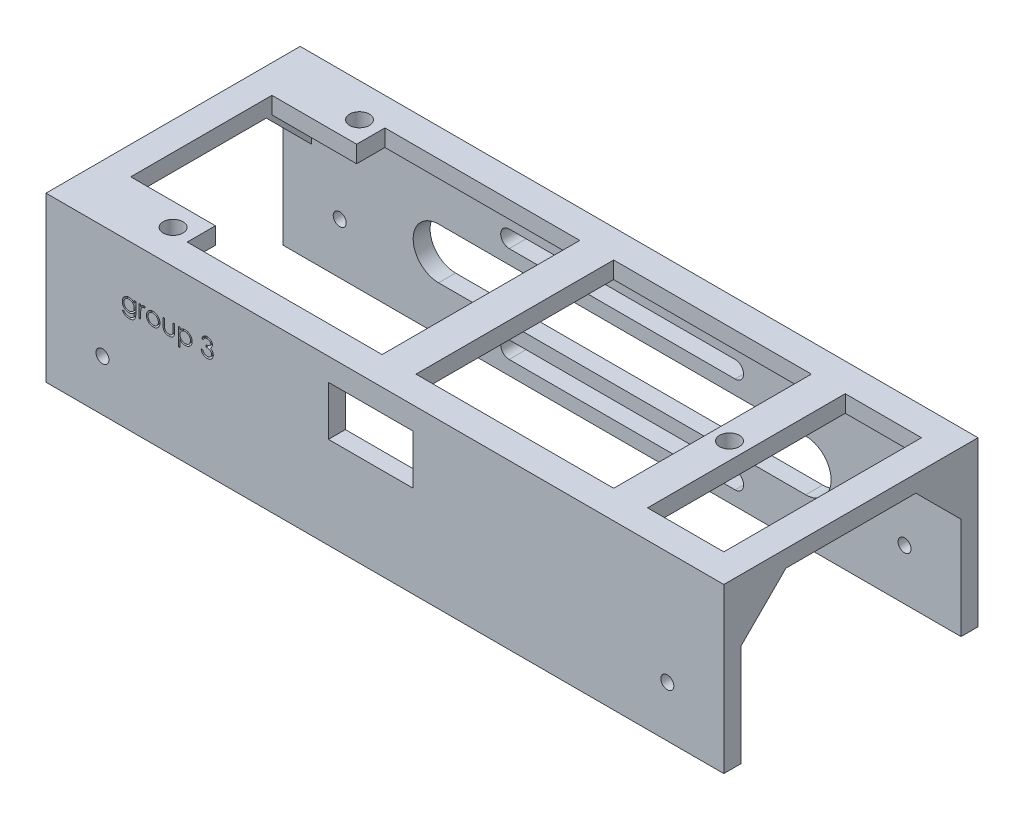
from build123d import *

# Parameters (mm, degrees)
SKETCH1_W           = 120
SKETCH1_H           = 29
BOSS_EXTRUDE5_DEPTH = 45
SHELL9_T            = -3
SKETCH3_R           = 1.15
CUT_EXTRUDE2_DEPTH  = 79
CUT_EXTRUDE8_DEPTH  = 23
SKETCH7_W           = 15
SKETCH7_H           = 8.75
CUT_EXTRUDE9_DEPTH  = 20
SKETCH13_W          = 110
SKETCH13_H          = 35
CUT_EXTRUDE14_DEPTH = 10
SKETCH17_W          = 15
SKETCH17_H          = 5
SKETCH17_W_2        = 6
SKETCH17_H_2        = 35
BOSS_EXTRUDE6_DEPTH = 3
SKETCH17_4_R        = 1.75
CUT_EXTRUDE16_DEPTH = 10
CUT_EXTRUDE15_DEPTH = 1.5
BOSS_EXTRUDE7_DEPTH = 5
BOSS_EXTRUDE8_DEPTH = 5


with BuildPart() as part:
    # Sketch1 → Boss-Extrude5 (new body)
    with BuildSketch(Plane.XY):
        with Locations((60, 14.5)):
            Rectangle(SKETCH1_W, SKETCH1_H)
    extrude(amount=BOSS_EXTRUDE5_DEPTH)

    # Shell9
    shell9_openings = [part.faces().sort_by_distance(p)[0] for p in [
        (120, 14.5, 22.5),
        (60, 0, 22.5),
        (0, 14.5, 22.5),
    ]]
    offset(amount=SHELL9_T, openings=shell9_openings, kind=Kind.INTERSECTION)

    # Sketch3 → Cut-Extrude2 (cut)
    with BuildSketch(Plane(origin=(0, 0, 0), x_dir=(-1, 0, 0), z_dir=(0, 0, -1))):
        with Locations((-10, 9)):
            Circle(SKETCH3_R)
        with Locations((-110, 9)):
            Circle(SKETCH3_R)
    extrude(amount=-CUT_EXTRUDE2_DEPTH, mode=Mode.SUBTRACT)

    # Sketch6 → Cut-Extrude8 (cut)
    with BuildSketch(Plane(origin=(0, 0, 0), x_dir=(-1, 0, 0), z_dir=(0, 0, -1))):
        with BuildLine():
            Line((-40, 22.5), (-80, 22.5))
            ThreePointArc((-80, 22.5), (-81.5, 21), (-80, 19.5))
            Line((-80, 19.5), (-40, 19.5))
            ThreePointArc((-40, 19.5), (-38.5, 21), (-40, 22.5))
        make_face()
        with BuildLine():
            Line((-27.5, 17), (-92.5, 17))
            ThreePointArc((-92.5, 17), (-97, 12.5), (-92.5, 8))
            Line((-92.5, 8), (-27.5, 8))
            ThreePointArc((-27.5, 8), (-23, 12.5), (-27.5, 17))
        make_face()
        with BuildLine():
            ThreePointArc((-80, 5.5), (-81.5, 4), (-80, 2.5))
            Line((-80, 2.5), (-40, 2.5))
            ThreePointArc((-40, 2.5), (-38.5, 4), (-40, 5.5))
            Line((-40, 5.5), (-80, 5.5))
        make_face()
    extrude(amount=-CUT_EXTRUDE8_DEPTH, mode=Mode.SUBTRACT)

    # Sketch7 → Cut-Extrude9 (cut)
    with BuildSketch(Plane.XY.offset(45)):
        with Locations((57.5, 20.625)):
            Rectangle(SKETCH7_W, SKETCH7_H)
    extrude(amount=-CUT_EXTRUDE9_DEPTH, mode=Mode.SUBTRACT)

    # Sketch13 → Cut-Extrude14 (cut)
    with BuildSketch(Plane(origin=(0, 29, 0), x_dir=(1, 0, 0), z_dir=(0, 1, 0))):
        with Locations((60, -22.5)):
            Rectangle(SKETCH13_W, SKETCH13_H)
    extrude(amount=-CUT_EXTRUDE14_DEPTH, mode=Mode.SUBTRACT)

    # Sketch17 → Boss-Extrude6 (add)
    with BuildSketch(Plane(origin=(0, 29, 0), x_dir=(1, 0, 0), z_dir=(0, 1, 0))):
        with Locations((12.5, -7.5)):
            Rectangle(SKETCH17_W, SKETCH17_H)
        with Locations((12.5, -37.5)):
            Rectangle(SKETCH17_W, SKETCH17_H)
        with Locations((57.5, -22.5)):
            Rectangle(SKETCH17_W_2, SKETCH17_H_2)
        with Locations((98.5, -22.5)):
            Rectangle(SKETCH17_W_2, SKETCH17_H_2)
    extrude(amount=-BOSS_EXTRUDE6_DEPTH)

    # Sketch17<4> → Cut-Extrude16 (cut)
    with BuildSketch(Plane(origin=(0, 29, 0), x_dir=(1, 0, 0), z_dir=(0, 1, 0))):
        with Locations((98.5, -22.5)):
            Circle(SKETCH17_4_R)
        with Locations((16.5, -6)):
            Circle(SKETCH17_4_R)
        with Locations((16.5, -39)):
            Circle(SKETCH17_4_R)
    extrude(amount=-CUT_EXTRUDE16_DEPTH, mode=Mode.SUBTRACT)

    # Sketch20 → Cut-Extrude15 (cut)
    # profile 1 of 6: a face of its own
    with BuildSketch(Plane.XY.offset(45)):
        with BuildLine():
            Line((15.616704574, 20.332761713), (15.901640472, 20.332761713))
            Line((15.901640472, 20.332761713), (15.901640472, 18.49149068))
            add(Edge.make_bspline(
                [(15.901640472, 18.49149068), (15.901389155, 18.452268005), (15.900904052, 18.376558794), (15.897410671, 18.267086354), (15.890044057, 18.165970691), (15.881690467, 18.072750642), (15.869673803, 17.9878583), (15.854999527, 17.91104035), (15.838457161, 17.842223075), (15.823924535, 17.799836969), (15.817050127, 17.779786954)],
                knots=[0, 0, 0, 0, 1.307562039, 2.523909702, 3.650326591, 4.686913197, 5.643429486, 6.506965704, 7.293745905, 8, 8, 8, 8], degree=3))
            add(Edge.make_bspline(
                [(15.817050127, 17.779786954), (15.806899889, 17.753724811), (15.786902899, 17.702379766), (15.749450931, 17.629595775), (15.707510176, 17.561064407), (15.659606909, 17.497167576), (15.605957751, 17.438226048), (15.547826683, 17.382959277), (15.484081581, 17.332536497), (15.414758892, 17.287827692), (15.341456639, 17.247562292), (15.264216961, 17.212685764), (15.183475406, 17.182308413), (15.098473497, 17.159554734), (15.010543928, 17.139838237), (14.918652687, 17.127006986), (14.823336649, 17.118273869), (14.758525483, 17.117466301), (14.725643877, 17.117056585)],
                knots=[0, 0, 0, 0, 0.981931301, 1.934503488, 2.87077864, 3.801706999, 4.735015492, 5.667491629, 6.616593066, 7.585388521, 8.561939025, 9.551802639, 10.560317337, 11.588439944, 12.640189604, 13.723962949, 14.845264515, 16, 16, 16, 16], degree=3))
            add(Edge.make_bspline(
                [(14.725643877, 17.117056585), (14.677669868, 17.11783354), (14.583963739, 17.119351142), (14.447343495, 17.137032186), (14.317590571, 17.162027939), (14.196419457, 17.19986072), (14.084595869, 17.246158561), (13.982883496, 17.299312554), (13.89219542, 17.360262855), (13.810440374, 17.429659829), (13.736651931, 17.512176883), (13.667230747, 17.609421549), (13.600409749, 17.722875084), (13.561249628, 17.806144188), (13.540743036, 17.849748893)],
                knots=[0, 0, 0, 0, 1.157897085, 2.2616841, 3.32207898, 4.345638746, 5.321241055, 6.241986252, 7.112515963, 7.955008012, 8.825025602, 9.77857164, 10.836726669, 12, 12, 12, 12], degree=3))
            Line((13.540743036, 17.849748893), (13.825678933, 17.849748893))
            add(Edge.make_bspline(
                [(13.825678933, 17.849748893), (13.848595366, 17.813367134), (13.89339417, 17.742245276), (13.977167435, 17.650158342), (14.068976031, 17.571460647), (14.171918315, 17.508041587), (14.286422618, 17.460226276), (14.412557826, 17.426140115), (14.55135034, 17.405732787), (14.647977577, 17.403273256), (14.698295119, 17.401992483)],
                knots=[0, 0, 0, 0, 0.997731894, 1.950442991, 2.880492273, 3.800895997, 4.748200782, 5.754801363, 6.83083817, 8, 8, 8, 8], degree=3))
            add(Edge.make_bspline(
                [(14.698295119, 17.401992483), (14.747976513, 17.403289832), (14.843757266, 17.405790991), (14.981489827, 17.426149222), (15.107215235, 17.460233694), (15.220209131, 17.507957016), (15.319138293, 17.566422742), (15.404420599, 17.631737095), (15.473494698, 17.705379862), (15.519952175, 17.773217644), (15.548830721, 17.833655247), (15.567220536, 17.885682245), (15.582164779, 17.944513069), (15.594665061, 18.009950487), (15.604980103, 18.08208799), (15.611514147, 18.161090521), (15.616236561, 18.246778529), (15.616544963, 18.306190162), (15.616704574, 18.336938396)],
                knots=[0, 0, 0, 0, 1.570740765, 3.028230971, 4.391408896, 5.680370741, 6.894727393, 8.017376726, 9.065722033, 10.075533815, 10.603371122, 11.180248986, 11.817768598, 12.521299649, 13.286540596, 14.121245857, 15.027658897, 16, 16, 16, 16], degree=3))
            Line((15.616704574, 18.336938396), (15.616704574, 18.457145728))
            add(Edge.make_bspline(
                [(15.616704574, 18.457145728), (15.587783846, 18.422727093), (15.530451097, 18.354495237), (15.431438879, 18.265085752), (15.323292106, 18.188081905), (15.206194892, 18.124927858), (15.083015558, 18.074416852), (14.955088249, 18.039090023), (14.823559742, 18.016266399), (14.734431006, 18.013810477), (14.689390872, 18.012569406)],
                knots=[0, 0, 0, 0, 1.012485704, 2.007162095, 2.997754123, 3.998611389, 4.999708251, 5.992315798, 6.98544096, 8, 8, 8, 8], degree=3))
            add(Edge.make_bspline(
                [(14.689390872, 18.012569406), (14.662869399, 18.013036608), (14.610140308, 18.013965485), (14.531804216, 18.022092376), (14.454624104, 18.033884092), (14.378779973, 18.051193683), (14.304162381, 18.073411178), (14.230894637, 18.101184934), (14.158383509, 18.132585791), (14.087947043, 18.169572548), (14.020286767, 18.210722641), (13.955913021, 18.255298635), (13.895162989, 18.303067225), (13.838614888, 18.354499449), (13.786342893, 18.409520868), (13.737643956, 18.467544948), (13.693323362, 18.52938192), (13.652471645, 18.593904232), (13.617040867, 18.661541641), (13.585940044, 18.730827485), (13.558898655, 18.801613615), (13.537340041, 18.874137022), (13.520874388, 18.948351984), (13.508618682, 19.02413692), (13.501667308, 19.1017252), (13.500583341, 19.153995995), (13.500037908, 19.180297771)],
                knots=[0, 0, 0, 0, 1.028754217, 2.045334182, 3.052854819, 4.056607503, 5.061168794, 6.071104265, 7.095078842, 8.125279047, 9.155117945, 10.165957491, 11.161587969, 12.151493252, 13.128948131, 14.104219989, 15.088194871, 16.07871515, 17.064853787, 18.047899887, 19.02414258, 20.002704429, 20.980574569, 21.971845993, 22.979467364, 24, 24, 24, 24], degree=3))
            add(Edge.make_bspline(
                [(13.500037908, 19.180297771), (13.500508866, 19.206607723), (13.501448958, 19.259125723), (13.509568775, 19.337030594), (13.521151346, 19.413892296), (13.53948268, 19.488918582), (13.561546682, 19.562963892), (13.588873066, 19.635481306), (13.621728655, 19.706492911), (13.658930356, 19.776051293), (13.700735212, 19.843223058), (13.746575391, 19.907019373), (13.796506234, 19.966970786), (13.8498389, 20.023682111), (13.907224591, 20.07660618), (13.96863362, 20.125614541), (14.033460661, 20.171528693), (14.101906631, 20.213358264), (14.172915405, 20.250353587), (14.24468294, 20.284110729), (14.31815991, 20.310902394), (14.391976428, 20.334509063), (14.467432493, 20.351232418), (14.543602915, 20.364134024), (14.620748464, 20.371994163), (14.672412876, 20.372975315), (14.698295119, 20.373466842)],
                knots=[0, 0, 0, 0, 1.008818848, 2.013730394, 3.001654427, 3.987803273, 4.973046549, 5.963777569, 6.957074694, 7.972068341, 8.987420212, 9.989399531, 10.982630087, 11.977756091, 12.973280677, 13.973972381, 14.989194003, 16.018387222, 17.047741039, 18.059210846, 19.057554164, 20.045176975, 21.029480261, 22.018708529, 23.007435371, 24, 24, 24, 24], degree=3))
            add(Edge.make_bspline(
                [(14.698295119, 20.373466842), (14.740977042, 20.372236145), (14.825260726, 20.369805898), (14.949295278, 20.350736716), (15.068985739, 20.320334718), (15.18500751, 20.276777682), (15.298305708, 20.217314433), (15.408506924, 20.138989044), (15.515929996, 20.04109895), (15.582222028, 19.966030281), (15.616704574, 19.926982467)],
                knots=[0, 0, 0, 0, 0.96728863, 1.910097829, 2.838038873, 3.762875196, 4.71315279, 5.730631239, 6.819562287, 8, 8, 8, 8], degree=3))
            Line((15.616704574, 19.926982467), (15.616704574, 20.332761713))
        make_face()
        with BuildLine():
            add(Edge.make_bspline(
                [(14.721191754, 20.088530944), (14.679526044, 20.087114835), (14.597036773, 20.084311238), (14.476125205, 20.060376534), (14.359396844, 20.022869897), (14.249083349, 19.969219095), (14.145753328, 19.903819322), (14.054064026, 19.824589204), (13.973868138, 19.734105154), (13.90602933, 19.633185287), (13.852025876, 19.524307938), (13.813795774, 19.409544629), (13.78907611, 19.290749742), (13.78634774, 19.209676024), (13.784973805, 19.168849454)],
                knots=[0, 0, 0, 0, 1.026226791, 2.031711442, 3.026614839, 4.04107745, 5.047145931, 6.032893242, 7.017642609, 8.019221815, 9.021877557, 10.003543541, 10.994637589, 12, 12, 12, 12], degree=3))
            add(Edge.make_bspline(
                [(13.784973805, 19.168849454), (13.78563217, 19.138067128), (13.786926982, 19.077527295), (13.799376227, 18.988683633), (13.819497532, 18.904065063), (13.848015569, 18.823666466), (13.883351228, 18.747026688), (13.927794307, 18.674673668), (13.980091974, 18.60654297), (14.039834895, 18.543138509), (14.105672041, 18.485388916), (14.177081601, 18.434645122), (14.25396672, 18.393142682), (14.334436469, 18.357273494), (14.42044337, 18.331076054), (14.510748612, 18.311083733), (14.605991079, 18.299645788), (14.670916871, 18.298228108), (14.704019278, 18.297505303)],
                knots=[0, 0, 0, 0, 1.039728707, 2.044842319, 3.024901384, 3.974314358, 4.923051295, 5.871625912, 6.837440708, 7.820715446, 8.810779094, 9.792721783, 10.773906224, 11.758876063, 12.764959493, 13.806266761, 14.881525401, 16, 16, 16, 16], degree=3))
            add(Edge.make_bspline(
                [(14.704019278, 18.297505303), (14.737550687, 18.298201634), (14.803121003, 18.299563302), (14.898888923, 18.311268619), (14.989632909, 18.330157126), (15.075269755, 18.356975013), (15.1561228, 18.39119403), (15.231283772, 18.434497961), (15.302364264, 18.483814268), (15.367094722, 18.541338023), (15.425627358, 18.604733697), (15.476636696, 18.673717281), (15.520101946, 18.747250752), (15.556095261, 18.825325821), (15.583573711, 18.908549241), (15.60200586, 18.996712964), (15.614893407, 19.089394606), (15.616091675, 19.152902422), (15.616704574, 19.185385912)],
                knots=[0, 0, 0, 0, 1.121943988, 2.193949579, 3.223793937, 4.220241907, 5.192961521, 6.155822191, 7.11847367, 8.083710714, 9.04790392, 10.001595906, 10.949595423, 11.902125208, 12.873731292, 13.87582262, 14.913508608, 16, 16, 16, 16], degree=3))
            add(Edge.make_bspline(
                [(15.616704574, 19.185385912), (15.615489395, 19.227674965), (15.613115361, 19.310292915), (15.59071151, 19.430676912), (15.554588891, 19.543859923), (15.503927909, 19.649483987), (15.440444229, 19.746429935), (15.363980388, 19.83290228), (15.27585506, 19.909012343), (15.176321441, 19.97241999), (15.069235544, 20.023642205), (14.957184173, 20.062070384), (14.840333683, 20.083836656), (14.761134297, 20.086957176), (14.721191754, 20.088530944)],
                knots=[0, 0, 0, 0, 1.070913519, 2.092188694, 3.091357305, 4.074328408, 5.051968682, 6.018948707, 6.99050112, 7.9935919, 9.000589572, 9.992915277, 10.987769056, 12, 12, 12, 12], degree=3))
        make_face(mode=Mode.SUBTRACT)
    # profile 2 of 6: a face of its own
    with BuildSketch(Plane.XY.offset(45)):
        with BuildLine():
            Line((16.471512267, 20.332761713), (16.756448164, 20.332761713))
            Line((16.756448164, 20.332761713), (16.756448164, 19.991220247))
            add(Edge.make_bspline(
                [(16.756448164, 19.991220247), (16.777483681, 20.023020891), (16.817713944, 20.083839376), (16.884582101, 20.1642751), (16.953074409, 20.230873035), (17.023518757, 20.283944084), (17.096433176, 20.323688842), (17.170217411, 20.352801809), (17.246032302, 20.370016945), (17.29697919, 20.372315336), (17.322503853, 20.373466842)],
                knots=[0, 0, 0, 0, 1.2804753, 2.448899062, 3.506932113, 4.484331642, 5.4025378, 6.288909075, 7.142734305, 8, 8, 8, 8], degree=3))
            add(Edge.make_bspline(
                [(17.322503853, 20.373466842), (17.342303449, 20.372386864), (17.383042405, 20.37016474), (17.444712326, 20.354552063), (17.508251743, 20.329625571), (17.549202337, 20.306184798), (17.570550728, 20.293964638)],
                knots=[0, 0, 0, 0, 0.901110191, 1.854092781, 2.881294221, 4, 4, 4, 4], degree=3))
            Line((17.570550728, 20.293964638), (17.414090392, 20.047189798))
            add(Edge.make_bspline(
                [(17.414090392, 20.047189798), (17.400384351, 20.053304183), (17.374367662, 20.064910455), (17.336308877, 20.078646421), (17.301219379, 20.08673443), (17.278864151, 20.087959724), (17.268442355, 20.088530944)],
                knots=[0, 0, 0, 0, 1.180555205, 2.24091978, 3.179933427, 4, 4, 4, 4], degree=3))
            add(Edge.make_bspline(
                [(17.268442355, 20.088530944), (17.245577154, 20.08700691), (17.198938771, 20.083898323), (17.130463547, 20.059460976), (17.064017868, 20.019977365), (17.01124786, 19.976188571), (16.970388102, 19.933963069), (16.941232326, 19.897089161), (16.914487262, 19.855742831), (16.888932848, 19.810630903), (16.865649853, 19.760983115), (16.843919546, 19.707295485), (16.824271863, 19.649505833), (16.813068427, 19.609244546), (16.807329574, 19.588621088)],
                knots=[0, 0, 0, 0, 1.125678352, 2.296057538, 3.5422874, 4.923748041, 5.663163013, 6.437101912, 7.23742474, 8.08941207, 8.991984279, 9.93940061, 10.944477711, 12, 12, 12, 12], degree=3))
            add(Edge.make_bspline(
                [(16.807329574, 19.588621088), (16.803036618, 19.570226795), (16.793528044, 19.529484834), (16.784282864, 19.461132958), (16.775148372, 19.380375782), (16.768710726, 19.286988515), (16.762743502, 19.18120437), (16.759377927, 19.06286219), (16.756562935, 18.931840507), (16.756487582, 18.840242344), (16.756448164, 18.792327018)],
                knots=[0, 0, 0, 0, 0.566838948, 1.255505196, 2.06880316, 3.007127437, 4.065329342, 5.249902469, 6.561414163, 8, 8, 8, 8], degree=3))
            Line((16.756448164, 18.792327018), (16.756448164, 18.012569406))
            Line((16.756448164, 18.012569406), (16.471512267, 18.012569406))
            Line((16.471512267, 18.012569406), (16.471512267, 20.332761713))
        make_face()
    # profile 3 of 6: a face of its own
    with BuildSketch(Plane.XY.offset(45)):
        with BuildLine():
            add(Edge.make_bspline(
                [(18.976149687, 20.373466842), (19.019684627, 20.37253984), (19.105046006, 20.370722218), (19.230057445, 20.351295784), (19.349387675, 20.321589247), (19.463493721, 20.280521473), (19.570914218, 20.225474275), (19.673213846, 20.159788703), (19.770112133, 20.081971636), (19.828190167, 20.021775389), (19.857670119, 19.991220247)],
                knots=[0, 0, 0, 0, 1.054011418, 2.066658804, 3.057071809, 4.030435133, 4.997543892, 5.974964718, 6.972108034, 8, 8, 8, 8], degree=3))
            add(Edge.make_bspline(
                [(19.857670119, 19.991220247), (19.883053749, 19.96199756), (19.933329765, 19.904117725), (19.997796525, 19.810268705), (20.053333226, 19.713077328), (20.09784034, 19.611252967), (20.132933183, 19.505684516), (20.157848493, 19.39600912), (20.172668427, 19.282468991), (20.174666833, 19.205358366), (20.175678933, 19.166305383)],
                knots=[0, 0, 0, 0, 1.025258237, 2.030674902, 3.01204498, 3.988269485, 4.97094183, 5.956517959, 6.965070386, 8, 8, 8, 8], degree=3))
            add(Edge.make_bspline(
                [(20.175678933, 19.166305383), (20.17478872, 19.127026045), (20.173029618, 19.049408242), (20.156389337, 18.935090674), (20.130507566, 18.824242513), (20.093467256, 18.717327841), (20.045970971, 18.614019848), (19.98801299, 18.514769757), (19.919186595, 18.41938175), (19.841168683, 18.328665797), (19.754943053, 18.245057873), (19.661401975, 18.172188657), (19.562383673, 18.109757703), (19.456571489, 18.059468955), (19.344931697, 18.019818012), (19.227223499, 17.991968712), (19.103629757, 17.975130613), (19.019240778, 17.972968371), (18.976149687, 17.971864278)],
                knots=[0, 0, 0, 0, 0.998656419, 1.973391657, 2.932242238, 3.890759089, 4.846373663, 5.82037756, 6.809684879, 7.83454468, 8.860553229, 9.859544525, 10.845671541, 11.83227036, 12.833544569, 13.85385346, 14.904124723, 16, 16, 16, 16], degree=3))
            add(Edge.make_bspline(
                [(18.976149687, 17.971864278), (18.932847477, 17.972972077), (18.848037911, 17.975141758), (18.724007913, 17.991903293), (18.606088759, 18.019805177), (18.494302816, 18.05959926), (18.388035705, 18.10975931), (18.288443668, 18.171999915), (18.194826602, 18.245079484), (18.10858273, 18.328659941), (18.03056971, 18.419383259), (17.961742052, 18.514769365), (17.903784399, 18.61401995), (17.856288029, 18.717327814), (17.819247741, 18.824242521), (17.793365964, 18.935090672), (17.776725685, 19.049408242), (17.774966583, 19.127026045), (17.774076369, 19.166305383)],
                knots=[0, 0, 0, 0, 1.099876186, 2.154163076, 3.173186993, 4.173200201, 5.163417411, 6.152872554, 7.150605724, 8.17532212, 9.198891216, 10.186952605, 11.159729845, 12.11414092, 13.071450619, 14.029093627, 15.002601286, 16, 16, 16, 16], degree=3))
            add(Edge.make_bspline(
                [(17.774076369, 19.166305383), (17.775095372, 19.205146107), (17.777112823, 19.282044065), (17.791917856, 19.395370756), (17.816735975, 19.50486053), (17.851870885, 19.610021498), (17.896788237, 19.711399643), (17.951544548, 19.808831168), (18.016668907, 19.902255816), (18.066744963, 19.960060846), (18.092085183, 19.989312194)],
                knots=[0, 0, 0, 0, 1.031353054, 2.041901799, 3.029428768, 4.008703097, 4.981709435, 5.96992636, 6.972712378, 8, 8, 8, 8], degree=3))
            add(Edge.make_bspline(
                [(18.092085183, 19.989312194), (18.121520691, 20.020132318), (18.179410796, 20.080745514), (18.276791428, 20.158335732), (18.378839394, 20.22538817), (18.487447005, 20.279341594), (18.601459312, 20.321830821), (18.721401054, 20.351372396), (18.8468367, 20.370652225), (18.932615785, 20.372519286), (18.976149687, 20.373466842)],
                knots=[0, 0, 0, 0, 1.027980169, 2.021703884, 2.998553061, 3.971491411, 4.943284454, 5.930300938, 6.949603206, 8, 8, 8, 8], degree=3))
        make_face()
        with BuildLine():
            add(Edge.make_bspline(
                [(18.974877651, 20.088530944), (18.94409139, 20.087655922), (18.883313609, 20.085928465), (18.793851557, 20.072789495), (18.707727274, 20.05197283), (18.624777366, 20.022396294), (18.545281559, 19.984206578), (18.469163744, 19.937299709), (18.396200031, 19.882296955), (18.327817731, 19.819284389), (18.26505949, 19.750451301), (18.210197326, 19.67711029), (18.163547408, 19.600450961), (18.124685264, 19.520393598), (18.095740886, 19.436126908), (18.074719644, 19.348605193), (18.061593069, 19.257650137), (18.059881854, 19.195818356), (18.059012267, 19.16439733)],
                knots=[0, 0, 0, 0, 1.021534396, 2.016698045, 2.994645724, 3.958388632, 4.93408049, 5.916473867, 6.921342795, 7.962252576, 8.998418191, 10.008913653, 10.997312074, 11.973003931, 12.956656626, 13.948281152, 14.957379055, 16, 16, 16, 16], degree=3))
            add(Edge.make_bspline(
                [(18.059012267, 19.16439733), (18.060469885, 19.123800849), (18.063362986, 19.043224424), (18.08688995, 18.924560048), (18.126247504, 18.810639368), (18.179394536, 18.702130218), (18.245984463, 18.601734651), (18.324440588, 18.512225519), (18.413920888, 18.434949819), (18.513358713, 18.370832194), (18.620722987, 18.319887273), (18.734348364, 18.283783917), (18.852858136, 18.260314596), (18.933848514, 18.257981901), (18.974877651, 18.256800175)],
                knots=[0, 0, 0, 0, 1.016792936, 2.018143844, 3.017858371, 4.030088057, 5.03801393, 6.028138512, 7.003788237, 7.991172063, 8.984598303, 9.972568034, 10.972917682, 12, 12, 12, 12], degree=3))
            add(Edge.make_bspline(
                [(18.974877651, 18.256800175), (19.015904429, 18.257988786), (19.096890148, 18.260335072), (19.215235258, 18.283665716), (19.328550076, 18.320045465), (19.435802834, 18.370774898), (19.535195396, 18.435193303), (19.625319242, 18.51178916), (19.703105482, 18.601971725), (19.769629538, 18.702263197), (19.82364694, 18.810471145), (19.862820273, 18.924581074), (19.886403798, 19.043219069), (19.889289264, 19.123799055), (19.890743036, 19.16439733)],
                knots=[0, 0, 0, 0, 1.02726834, 2.027799167, 3.010890988, 4.004497153, 4.992059811, 5.971914811, 6.958719428, 7.966827853, 8.981595046, 9.981490638, 10.983022906, 12, 12, 12, 12], degree=3))
            add(Edge.make_bspline(
                [(19.890743036, 19.16439733), (19.889873748, 19.195818544), (19.888163122, 19.257650694), (19.875032262, 19.348603063), (19.854026879, 19.436134725), (19.825024055, 19.520364757), (19.786330771, 19.600658243), (19.738781252, 19.67688521), (19.684143107, 19.750705362), (19.620627576, 19.819061879), (19.552316655, 19.882321519), (19.47932337, 19.937321037), (19.403318425, 19.984000427), (19.324053568, 20.022722945), (19.241093025, 20.051703747), (19.155089415, 20.072909691), (19.066009066, 20.085872941), (19.005449077, 20.087639276), (18.974877651, 20.088530944)],
                knots=[0, 0, 0, 0, 1.042956736, 2.052379634, 3.044323526, 4.02829302, 5.004299113, 5.996692471, 7.007513377, 8.048758398, 9.090003419, 10.095195979, 11.07790575, 12.047570684, 13.018257071, 13.989683339, 14.985167495, 16, 16, 16, 16], degree=3))
        make_face(mode=Mode.SUBTRACT)
    # profile 4 of 6: a face of its own
    with BuildSketch(Plane.XY.offset(45)):
        with BuildLine():
            Line((20.7048456, 20.332761713), (20.989781497, 20.332761713))
            Line((20.989781497, 20.332761713), (20.989781497, 19.256619887))
            add(Edge.make_bspline(
                [(20.989781497, 19.256619887), (20.989910225, 19.225030678), (20.990156476, 19.164602003), (20.991826473, 19.077647655), (20.995754486, 18.998348208), (21.000665598, 18.926657854), (21.00698125, 18.86258872), (21.014495442, 18.806364589), (21.022894153, 18.757347865), (21.031115329, 18.727826393), (21.034938749, 18.71409685)],
                knots=[0, 0, 0, 0, 1.388932606, 2.656963016, 3.823490214, 4.879454478, 5.816252168, 6.653371382, 7.373723809, 8, 8, 8, 8], degree=3))
            add(Edge.make_bspline(
                [(21.034938749, 18.71409685), (21.041072355, 18.696840388), (21.05321205, 18.662686223), (21.075231567, 18.613347625), (21.102471558, 18.567650048), (21.132280116, 18.523831353), (21.166660293, 18.483189551), (21.205177099, 18.445793272), (21.246541214, 18.410229561), (21.3080047, 18.368151928), (21.392059891, 18.323053022), (21.502416319, 18.284140387), (21.622072295, 18.260885035), (21.704771719, 18.258186961), (21.747278493, 18.256800175)],
                knots=[0, 0, 0, 0, 0.725840625, 1.436591201, 2.137033971, 2.831655856, 3.53531722, 4.242432219, 4.957935707, 5.694543706, 7.190802206, 8.724350549, 10.316345118, 12, 12, 12, 12], degree=3))
            add(Edge.make_bspline(
                [(21.747278493, 18.256800175), (21.789781318, 18.258216451), (21.872016419, 18.260956682), (21.990357713, 18.283438892), (22.098535782, 18.320999767), (22.195464859, 18.373439347), (22.2807053, 18.437612504), (22.351738594, 18.512913352), (22.410346603, 18.596959582), (22.435936578, 18.659665178), (22.448805937, 18.691200215)],
                knots=[0, 0, 0, 0, 1.157059328, 2.238695713, 3.266970494, 4.264342957, 5.228770407, 6.160125903, 7.074715775, 8, 8, 8, 8], degree=3))
            add(Edge.make_bspline(
                [(22.448805937, 18.691200215), (22.452610702, 18.703869643), (22.46102211, 18.731878654), (22.470059386, 18.779394569), (22.478200505, 18.836058889), (22.485152101, 18.902242407), (22.490109784, 18.977772166), (22.492782251, 19.062624564), (22.495801472, 19.156533227), (22.495847297, 19.222271837), (22.495871241, 19.256619887)],
                knots=[0, 0, 0, 0, 0.557542046, 1.232589297, 2.036731608, 2.971723315, 4.038036528, 5.22795436, 6.551621927, 8, 8, 8, 8], degree=3))
            Line((22.495871241, 19.256619887), (22.495871241, 20.332761713))
            Line((22.495871241, 20.332761713), (22.780807138, 20.332761713))
            Line((22.780807138, 20.332761713), (22.780807138, 19.203194406))
            add(Edge.make_bspline(
                [(22.780807138, 19.203194406), (22.780406458, 19.164815757), (22.779629084, 19.09035593), (22.774633136, 18.9821482), (22.766060988, 18.881308163), (22.753050123, 18.787782443), (22.737750547, 18.701642441), (22.7180145, 18.622777758), (22.694448527, 18.551431377), (22.667864238, 18.486351337), (22.636457258, 18.427344511), (22.60304989, 18.371341306), (22.564473847, 18.319731286), (22.523860848, 18.269945348), (22.478683632, 18.224459819), (22.42978876, 18.18223098), (22.377864429, 18.142613302), (22.321758371, 18.107151927), (22.262289657, 18.075205398), (22.199384872, 18.046887956), (22.132273538, 18.02447919), (22.061821525, 18.005147372), (21.98768366, 17.98998496), (21.909931418, 17.97929286), (21.828590988, 17.972738453), (21.773155978, 17.972160562), (21.744734422, 17.971864278)],
                knots=[0, 0, 0, 0, 1.493040784, 2.896703357, 4.213163133, 5.428574705, 6.569057535, 7.615249723, 8.588095153, 9.490268104, 10.346124644, 11.18633936, 12.024365274, 12.850166724, 13.684164916, 14.514361689, 15.362232829, 16.222528818, 17.093394965, 17.986930858, 18.902426812, 19.842810585, 20.827885679, 21.843828298, 22.894529745, 24, 24, 24, 24], degree=3))
            add(Edge.make_bspline(
                [(21.744734422, 17.971864278), (21.716525441, 17.97217244), (21.661092168, 17.972778009), (21.57974754, 17.979256649), (21.501779875, 17.989968347), (21.427466371, 18.005258437), (21.356732454, 18.024343879), (21.289291607, 18.047025657), (21.225933518, 18.075220094), (21.165896986, 18.106949736), (21.109651962, 18.142841093), (21.056939181, 18.1821821), (21.007829322, 18.224914029), (20.962311553, 18.270858417), (20.921024781, 18.320585209), (20.883454515, 18.373694396), (20.849022361, 18.429659748), (20.817859472, 18.489588474), (20.791088094, 18.555421654), (20.767452264, 18.628262592), (20.748120471, 18.708909875), (20.732388374, 18.797294553), (20.719732425, 18.892993627), (20.71094571, 18.996560689), (20.706032778, 19.107743467), (20.705249858, 19.18453301), (20.7048456, 19.224182988)],
                knots=[0, 0, 0, 0, 1.083640291, 2.129454052, 3.13281866, 4.105697902, 5.042300162, 5.946461698, 6.836384745, 7.703652036, 8.553297018, 9.397182691, 10.228592656, 11.052265423, 11.879314572, 12.708807002, 13.549817954, 14.402308542, 15.300838682, 16.27712199, 17.341985831, 18.484375296, 19.725102775, 21.0496083, 22.476576903, 24, 24, 24, 24], degree=3))
            Line((20.7048456, 19.224182988), (20.7048456, 20.332761713))
        make_face()
    # profile 5 of 6: a face of its own
    with BuildSketch(Plane.XY.offset(45)):
        with BuildLine():
            Line((23.43208919, 20.332761713), (23.717025087, 20.332761713))
            Line((23.717025087, 20.332761713), (23.717025087, 19.903449814))
            add(Edge.make_bspline(
                [(23.717025087, 19.903449814), (23.747285091, 19.942400473), (23.806089351, 20.018093283), (23.907439801, 20.116055757), (24.014416263, 20.198674068), (24.129771645, 20.263428223), (24.251713135, 20.312251388), (24.379740309, 20.348337032), (24.51493976, 20.369601798), (24.607374399, 20.372161448), (24.654515071, 20.373466842)],
                knots=[0, 0, 0, 0, 1.0828784, 2.104357462, 3.088488658, 4.04616522, 5.001424249, 5.969181776, 6.964304535, 8, 8, 8, 8], degree=3))
            add(Edge.make_bspline(
                [(24.654515071, 20.373466842), (24.69569174, 20.372275601), (24.777079588, 20.369921051), (24.896879803, 20.35397978), (25.012246044, 20.32665873), (25.122525636, 20.2872879), (25.228899988, 20.238614724), (25.329794321, 20.177185698), (25.42678019, 20.106060082), (25.517418447, 20.024206631), (25.601167116, 19.935643847), (25.673599009, 19.840373614), (25.736075665, 19.741528982), (25.786576577, 19.637577584), (25.826135578, 19.529337997), (25.854270321, 19.416372911), (25.87101404, 19.299101165), (25.873260536, 19.21936084), (25.874396882, 19.179025736)],
                knots=[0, 0, 0, 0, 1.041296284, 2.058176809, 3.050446431, 4.034000596, 5.01514041, 6.003636468, 7.015969324, 8.052561599, 9.08815499, 10.094063707, 11.074456064, 12.040834395, 13.011057502, 13.983766392, 14.980127149, 16, 16, 16, 16], degree=3))
            add(Edge.make_bspline(
                [(25.874396882, 19.179025736), (25.873285192, 19.137839356), (25.871092778, 19.056613871), (25.854088379, 18.93733629), (25.826913215, 18.822594172), (25.787853292, 18.712578369), (25.737378513, 18.607364628), (25.675960805, 18.507028826), (25.603492367, 18.41160311), (25.520669201, 18.322382979), (25.430814037, 18.240196459), (25.334768029, 18.16831621), (25.234021718, 18.107953677), (25.129090538, 18.057531992), (25.019076209, 18.019529797), (24.904492021, 17.992117935), (24.785400359, 17.975213785), (24.704391457, 17.972989342), (24.663419318, 17.971864278)],
                knots=[0, 0, 0, 0, 1.038740735, 2.04854663, 3.033179607, 4.009277356, 4.987731542, 5.972001279, 6.972200261, 8.005528982, 9.039189865, 10.040446548, 11.026516639, 11.997840187, 12.972163198, 13.956796175, 14.96660207, 16, 16, 16, 16], degree=3))
            add(Edge.make_bspline(
                [(24.663419318, 17.971864278), (24.617311449, 17.973038853), (24.52623489, 17.975358984), (24.393068432, 17.998871592), (24.264910145, 18.034011526), (24.143179897, 18.085445614), (24.026913381, 18.150991689), (23.916768272, 18.230920233), (23.812159503, 18.325064085), (23.749195845, 18.39648509), (23.717025087, 18.432977058)],
                knots=[0, 0, 0, 0, 1.014726462, 2.004382257, 2.969841629, 3.936926163, 4.907207904, 5.903978561, 6.929055279, 8, 8, 8, 8], degree=3))
            Line((23.717025087, 18.432977058), (23.717025087, 17.157761713))
            Line((23.717025087, 17.157761713), (23.43208919, 17.157761713))
            Line((23.43208919, 17.157761713), (23.43208919, 20.332761713))
        make_face()
        with BuildLine():
            add(Edge.make_bspline(
                [(24.651971001, 20.088530944), (24.619695255, 20.087950139), (24.55615263, 20.086806682), (24.46301426, 20.073223171), (24.373301979, 20.053503935), (24.287919923, 20.023648139), (24.206049721, 19.987000645), (24.128321943, 19.941206249), (24.05479115, 19.887093358), (23.985642343, 19.825698524), (23.923173499, 19.758048629), (23.867871414, 19.685851116), (23.821419073, 19.609197418), (23.782863669, 19.528801553), (23.753523691, 19.44403333), (23.732699574, 19.355375526), (23.719609182, 19.262731101), (23.717895646, 19.199633867), (23.717025087, 19.167577419)],
                knots=[0, 0, 0, 0, 1.05670511, 2.080379991, 3.077984906, 4.06214886, 5.038337365, 6.01289324, 7.01187578, 8.025460281, 9.038092164, 10.024533457, 11.000252242, 11.969694649, 12.940728589, 13.933144304, 14.949937299, 16, 16, 16, 16], degree=3))
            add(Edge.make_bspline(
                [(23.717025087, 19.167577419), (23.718468221, 19.125496774), (23.721295442, 19.043057226), (23.744280055, 18.922603059), (23.78168633, 18.808619057), (23.834780234, 18.702065116), (23.901861248, 18.604109258), (23.982686004, 18.516397065), (24.076523176, 18.439479886), (24.181812699, 18.374690606), (24.294681347, 18.322087146), (24.41241571, 18.284427827), (24.533396709, 18.261230162), (24.615192256, 18.258284834), (24.656423124, 18.256800175)],
                knots=[0, 0, 0, 0, 1.03728447, 2.032128127, 3.01272805, 3.987917167, 4.958271349, 5.931593992, 6.91984656, 7.941419022, 8.973179163, 9.983609215, 10.983593296, 12, 12, 12, 12], degree=3))
            add(Edge.make_bspline(
                [(24.656423124, 18.256800175), (24.696823428, 18.258212031), (24.777010768, 18.261014312), (24.895082778, 18.285269668), (25.009827857, 18.32232194), (25.118848442, 18.376350966), (25.221195463, 18.442563376), (25.313616587, 18.521992835), (25.394358573, 18.614058712), (25.463178381, 18.716573568), (25.518633371, 18.826496952), (25.56029866, 18.940235783), (25.584345723, 19.057389131), (25.587753667, 19.136308485), (25.589460985, 19.175845648)],
                knots=[0, 0, 0, 0, 1.00104056, 1.986885549, 2.97790532, 3.984399681, 4.995088187, 5.994304198, 6.996462723, 8.023150851, 9.048424203, 10.043036403, 11.019596776, 12, 12, 12, 12], degree=3))
            add(Edge.make_bspline(
                [(25.589460985, 19.175845648), (25.588141333, 19.215628388), (25.585512312, 19.294883921), (25.55961607, 19.411690268), (25.520699662, 19.525888647), (25.463949665, 19.63431086), (25.396638513, 19.736613063), (25.315225166, 19.826922653), (25.223951902, 19.905998906), (25.121726732, 19.971327171), (25.012016489, 20.023293299), (24.896523672, 20.061287742), (24.775834119, 20.08412393), (24.693621889, 20.087049017), (24.651971001, 20.088530944)],
                knots=[0, 0, 0, 0, 0.983928682, 1.960191568, 2.949917689, 3.96440592, 4.982380491, 5.975291189, 6.965713506, 7.964880129, 8.970154049, 9.96478489, 10.968906225, 12, 12, 12, 12], degree=3))
        make_face(mode=Mode.SUBTRACT)
    # profile 6 of 6: a face of its own
    with BuildSketch(Plane.XY.offset(45)):
        with BuildLine():
            Line((27.868948164, 20.454877098), (27.584012267, 20.454877098))
            add(Edge.make_bspline(
                [(27.584012267, 20.454877098), (27.591731645, 20.486837994), (27.606822398, 20.549318932), (27.638298054, 20.638588376), (27.672587378, 20.723064713), (27.71376178, 20.801166151), (27.758673293, 20.874462299), (27.810128904, 20.941290719), (27.865754653, 21.003351052), (27.927281571, 21.058426632), (27.991805428, 21.108299286), (28.060235405, 21.150821659), (28.131194744, 21.187401427), (28.205175086, 21.217536923), (28.282396685, 21.240238648), (28.362161414, 21.256709464), (28.444678304, 21.267405689), (28.50069219, 21.268449596), (28.529134462, 21.268979662)],
                knots=[0, 0, 0, 0, 1.162005537, 2.271625781, 3.343758855, 4.383309926, 5.390229558, 6.379919256, 7.361854164, 8.333198761, 9.295911338, 10.242430842, 11.177959212, 12.116337295, 13.062827104, 14.020064771, 14.994644689, 16, 16, 16, 16], degree=3))
            add(Edge.make_bspline(
                [(28.529134462, 21.268979662), (28.570575235, 21.267728503), (28.652552838, 21.265253477), (28.772987888, 21.242652524), (28.889126502, 21.206888297), (28.999697463, 21.157472844), (29.102402755, 21.096524353), (29.193784868, 21.023984913), (29.27260516, 20.941254118), (29.338730774, 20.849875292), (29.390505951, 20.752216366), (29.428684304, 20.651704794), (29.451926829, 20.548579006), (29.454939049, 20.478949189), (29.456448164, 20.444064798)],
                knots=[0, 0, 0, 0, 1.083050992, 2.142477498, 3.193116406, 4.255571735, 5.30263384, 6.308962982, 7.297363603, 8.282367274, 9.249857812, 10.179914175, 11.08814088, 12, 12, 12, 12], degree=3))
            add(Edge.make_bspline(
                [(29.456448164, 20.444064798), (29.455392621, 20.410494349), (29.453327086, 20.344802189), (29.435788653, 20.248897688), (29.406273615, 20.158508522), (29.365388902, 20.073254182), (29.312464781, 19.99367522), (29.248354549, 19.919592591), (29.172605706, 19.850677711), (29.115202669, 19.811199332), (29.085649887, 19.790874694)],
                knots=[0, 0, 0, 0, 1.024540389, 2.004866551, 2.965041327, 3.920577974, 4.882998113, 5.874504559, 6.905732034, 8, 8, 8, 8], degree=3))
            add(Edge.make_bspline(
                [(29.085649887, 19.790874694), (29.119424407, 19.774565924), (29.1863415, 19.742253534), (29.277555195, 19.678884383), (29.360357267, 19.605717553), (29.406534213, 19.548619575), (29.429735424, 19.519931185)],
                knots=[0, 0, 0, 0, 1.015518401, 2.012035669, 3.001164323, 4, 4, 4, 4], degree=3))
            add(Edge.make_bspline(
                [(29.429735424, 19.519931185), (29.445012927, 19.49901451), (29.475317754, 19.457523686), (29.512724274, 19.390815642), (29.546659685, 19.32336822), (29.573103098, 19.253373616), (29.59358082, 19.181643096), (29.608218507, 19.108053494), (29.617311835, 19.032544717), (29.618614085, 18.981461252), (29.619268677, 18.955783548)],
                knots=[0, 0, 0, 0, 1.025084078, 2.033381695, 3.024893161, 4.013698104, 4.991890475, 5.976764909, 6.982997093, 8, 8, 8, 8], degree=3))
            add(Edge.make_bspline(
                [(29.619268677, 18.955783548), (29.617640797, 18.91132473), (29.614392697, 18.822616317), (29.58536043, 18.691557105), (29.540354133, 18.563445399), (29.476439627, 18.440913224), (29.39854553, 18.326268164), (29.305874243, 18.223691798), (29.199478715, 18.135518778), (29.080819305, 18.0618495), (28.952261624, 18.00295967), (28.814760909, 17.962086133), (28.67029836, 17.935465119), (28.57123174, 17.932610459), (28.520866233, 17.931159149)],
                knots=[0, 0, 0, 0, 0.955779014, 1.907060117, 2.875433937, 3.871313158, 4.872415639, 5.851225146, 6.836215519, 7.83643374, 8.849228613, 9.86973379, 10.916971861, 12, 12, 12, 12], degree=3))
            add(Edge.make_bspline(
                [(28.520866233, 17.931159149), (28.486921582, 17.931946743), (28.420129828, 17.933496464), (28.321937512, 17.944090624), (28.22820997, 17.963439986), (28.138820478, 17.989477984), (28.053689623, 18.022490493), (27.973077185, 18.063601026), (27.89648721, 18.111962174), (27.824642448, 18.168144786), (27.757551461, 18.230992859), (27.696997204, 18.301622104), (27.641970106, 18.378726891), (27.59394357, 18.463202807), (27.550730048, 18.553958147), (27.515187323, 18.652154999), (27.483903986, 18.756915505), (27.469359344, 18.829920312), (27.461896882, 18.867377098)],
                knots=[0, 0, 0, 0, 1.048658725, 2.063410685, 3.046034179, 4.001477787, 4.936774919, 5.862367409, 6.792675028, 7.730719943, 8.675894397, 9.627829632, 10.600096036, 11.597688215, 12.626045268, 13.701542398, 14.82072376, 16, 16, 16, 16], degree=3))
            Line((27.461896882, 18.867377098), (27.74683278, 18.867377098))
            add(Edge.make_bspline(
                [(27.74683278, 18.867377098), (27.754256194, 18.842930493), (27.76869538, 18.795379723), (27.793273779, 18.726944589), (27.821275711, 18.664208355), (27.851315346, 18.606710808), (27.882864365, 18.5538857), (27.918165762, 18.507129862), (27.954604915, 18.464389643), (27.982072614, 18.440309888), (27.995515672, 18.428524935)],
                knots=[0, 0, 0, 0, 1.198163088, 2.33053128, 3.407730985, 4.417276592, 5.372219308, 6.28897303, 7.162600585, 8, 8, 8, 8], degree=3))
            add(Edge.make_bspline(
                [(27.995515672, 18.428524935), (28.013292567, 18.414819517), (28.048791482, 18.387450989), (28.106638378, 18.352524511), (28.16747581, 18.322261295), (28.232621979, 18.299143943), (28.300671092, 18.279569922), (28.372723059, 18.266760594), (28.448142206, 18.257972039), (28.499638677, 18.257196494), (28.525954374, 18.256800175)],
                knots=[0, 0, 0, 0, 0.946170439, 1.889420265, 2.845303464, 3.807233317, 4.801018734, 5.828864929, 6.890507805, 8, 8, 8, 8], degree=3))
            add(Edge.make_bspline(
                [(28.525954374, 18.256800175), (28.55566648, 18.257358889), (28.613765938, 18.258451406), (28.698542846, 18.268498654), (28.779194602, 18.283131244), (28.854825757, 18.305730878), (28.926427002, 18.333653508), (28.992994642, 18.368713133), (29.055402538, 18.409847273), (29.112851356, 18.456600653), (29.164509066, 18.507783009), (29.209992768, 18.561316295), (29.248659425, 18.616974797), (29.279850242, 18.675066521), (29.30447967, 18.735350908), (29.321246573, 18.797997131), (29.332904733, 18.862492508), (29.33385416, 18.906333787), (29.33433278, 18.92843479)],
                knots=[0, 0, 0, 0, 1.217147791, 2.380027433, 3.494444702, 4.572153297, 5.609568379, 6.639424714, 7.649109417, 8.668170816, 9.669597737, 10.625200337, 11.543417969, 12.441394052, 13.322311151, 14.205496177, 15.095365482, 16, 16, 16, 16], degree=3))
            add(Edge.make_bspline(
                [(29.33433278, 18.92843479), (29.332944577, 18.958017934), (29.330175081, 19.017037018), (29.309030869, 19.103866532), (29.274252043, 19.187526342), (29.225563407, 19.266589094), (29.166294568, 19.339864376), (29.097020688, 19.405243507), (29.017166509, 19.459191375), (28.943669914, 19.496464656), (28.878568665, 19.521898289), (28.822856137, 19.538839149), (28.760484076, 19.553184394), (28.692206745, 19.566530526), (28.617509684, 19.577889178), (28.536474216, 19.587361396), (28.449083918, 19.594940612), (28.388585503, 19.598325249), (28.357409703, 19.600069406)],
                knots=[0, 0, 0, 0, 1.07054697, 2.135767047, 3.216561865, 4.33974944, 5.486079747, 6.621378074, 7.775625952, 8.963672916, 9.598146892, 10.304877434, 11.070270905, 11.915000392, 12.823868403, 13.805723172, 14.86925407, 16, 16, 16, 16], degree=3))
            Line((28.357409703, 19.600069406), (28.357409703, 19.925710431))
            add(Edge.make_bspline(
                [(28.357409703, 19.925710431), (28.396690046, 19.926377003), (28.473630589, 19.927682654), (28.586020422, 19.943474206), (28.693492641, 19.965318776), (28.793665471, 19.998778915), (28.884968233, 20.037641184), (28.964179586, 20.08286426), (29.030189784, 20.133133354), (29.082678042, 20.189224364), (29.122165271, 20.249381585), (29.151036723, 20.312080268), (29.168091304, 20.377869952), (29.170367931, 20.422768686), (29.171512267, 20.445336834)],
                knots=[0, 0, 0, 0, 1.321986639, 2.589447074, 3.816329219, 5.01088745, 6.139805852, 7.153945165, 8.075214402, 8.924034688, 9.728124013, 10.488707548, 11.240355623, 12, 12, 12, 12], degree=3))
            add(Edge.make_bspline(
                [(29.171512267, 20.445336834), (29.171136337, 20.46191736), (29.170388442, 20.49490353), (29.160956626, 20.543095556), (29.146783388, 20.589814271), (29.127298205, 20.634860999), (29.101217668, 20.677923319), (29.070006523, 20.719368362), (29.032842604, 20.758959505), (28.990256377, 20.795862366), (28.944525668, 20.831031602), (28.894406229, 20.860888973), (28.841409243, 20.886420565), (28.785476034, 20.907474899), (28.726425089, 20.923312968), (28.664533855, 20.934684767), (28.599684313, 20.941794639), (28.555441385, 20.942818274), (28.532950568, 20.943338637)],
                knots=[0, 0, 0, 0, 0.884392785, 1.759457502, 2.611959086, 3.489218968, 4.37281399, 5.2945488, 6.255912374, 7.266815255, 8.301784654, 9.332968512, 10.37626691, 11.440494194, 12.520033166, 13.637162961, 14.798855837, 16, 16, 16, 16], degree=3))
            add(Edge.make_bspline(
                [(28.532950568, 20.943338637), (28.496799412, 20.942076472), (28.426187796, 20.939611172), (28.324392836, 20.918018439), (28.229760297, 20.883566892), (28.157425935, 20.842443367), (28.104011029, 20.80184833), (28.065841235, 20.766395023), (28.028357629, 20.726995247), (27.994026194, 20.681222292), (27.959306229, 20.63217599), (27.927697234, 20.577363079), (27.896981656, 20.518213378), (27.878473629, 20.476398052), (27.868948164, 20.454877098)],
                knots=[0, 0, 0, 0, 1.472543308, 2.876219568, 4.221790263, 5.565193594, 6.249813518, 6.953379497, 7.687249741, 8.463570142, 9.283606569, 10.136032583, 11.040678096, 12, 12, 12, 12], degree=3))
        make_face()
    extrude(amount=-CUT_EXTRUDE15_DEPTH, mode=Mode.SUBTRACT)

    # Sketch21 → Boss-Extrude7 (add)
    with BuildSketch(Plane.ZY):
        Polygon((3, 26), (3, 18), (11, 26), align=None)
        Polygon((42, 26), (34, 26), (42, 18), align=None)
    extrude(amount=-BOSS_EXTRUDE7_DEPTH)

    # Sketch22 → Boss-Extrude8 (add)
    with BuildSketch(Plane(origin=(120, 0, 0), x_dir=(0, 0, -1), z_dir=(1, 0, 0))):
        Polygon((-42, 26), (-42, 18), (-34, 26), align=None)
        Polygon((-11, 26), (-3, 26), (-3, 18), align=None)
    extrude(amount=-BOSS_EXTRUDE8_DEPTH)


solid = part.part
